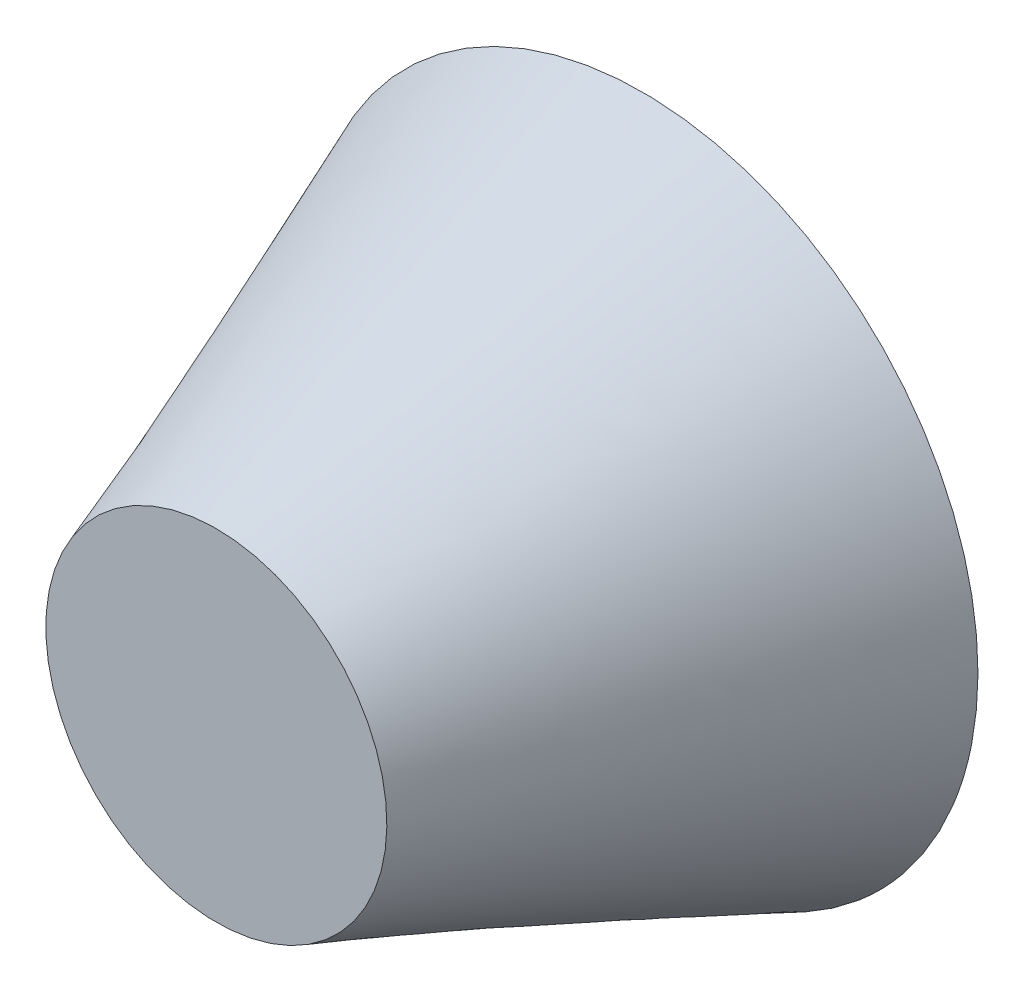
from build123d import *

# Parameters (mm, degrees)
SCHIZZO3_R               = 9.8
TAGLIO_ESTRUSIONE1_DEPTH = 0.5
SMUSSO1_SIZE             = 0.5


with BuildPart() as part:
    # Loft1: read off the stored shape, not the designer's step
    # Loft1: loft between two sections, ruled curve by curve
    loft1_from = [
        Edge.make_bspline([(-5.882123299, 1.183480248, 15), (-3.515162803, 12.947726846, 15), (8.249083795, 10.580766349, 15), (5.882123299, -1.183480248, 15), (3.515162803, -12.947726846, 15), (-8.249083795, -10.580766349, 15), (-5.882123299, 1.183480248, 15)], [0, 0, 0, 0, 0.5, 0.5, 0.5, 1, 1, 1, 1], 3, [1, 0.333333333, 0.333333333, 1, 0.333333333, 0.333333333, 1]),
    ]
    loft1_to = [
        Edge.make_bspline([(-10.160528027, 6.000305843, 0), (1.840083658, 26.321361897, 0), (22.161139713, 14.320750212, 0), (10.160528027, -6.000305843, 0), (-1.840083658, -26.321361897, 0), (-22.161139713, -14.320750212, 0), (-10.160528027, 6.000305843, 0)], [0, 0, 0, 0, 0.5, 0.5, 0.5, 1, 1, 1, 1], 3, [1, 0.333333333, 0.333333333, 1, 0.333333333, 0.333333333, 1]),
    ]
    loft1 = Solid(Shell([*[Face.make_surface_from_curves(loft1_from[k], loft1_to[k]) for k in range(1)], Face(Wire(loft1_from)), Face(Wire(loft1_to))]))
    add(loft1)

    # Schizzo3 → Taglio-Estrusione1 (cut)
    with BuildSketch(Plane(origin=(0, 0, 0), x_dir=(-1, 0, 0), z_dir=(0, 0, -1))):
        Circle(SCHIZZO3_R)
    extrude(amount=-TAGLIO_ESTRUSIONE1_DEPTH, mode=Mode.SUBTRACT)

    # Smusso1
    smusso1_edges = [part.edges().sort_by_distance(p)[0] for p in [
        (9.8, 0, 0),
    ]]
    chamfer(smusso1_edges, length=SMUSSO1_SIZE - 0.0001)  # a hair under: the kernel refuses the full size


solid = part.part
